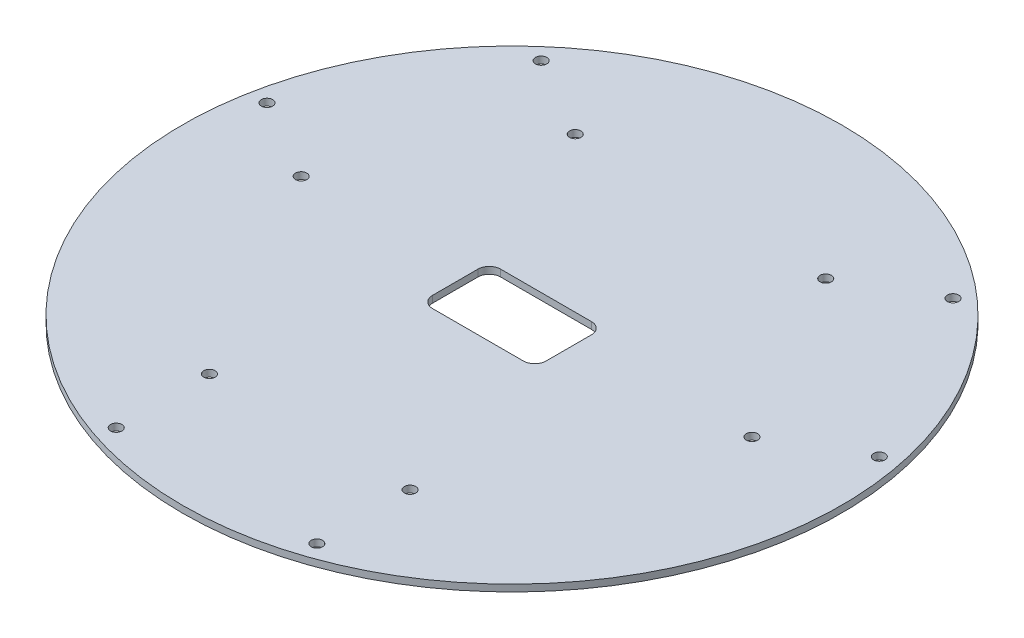
from build123d import *

# Parameters (mm, degrees)
SKETCH_1_R                   = 145
EXTRUDE_1_DEPTH              = 3
SKETCH_2_R                   = 2.5
CUT_EXTRUDE_1_DEPTH          = 10
PATTERN_CIRCULAR_1_OUTLINE_R = 2.5
PATTERN_CIRCULAR_1_DEPTH     = 3
SKETCH_5_W                   = 50
SKETCH_5_H                   = 30
CUT_EXTRUDE_2_DEPTH          = 10
FILLET_1_R                   = 5


# Read off the part's stored shape, not the designer's step: 阵列(圆周)1
with BuildPart() as part:
    # 草图1 → 凸台-拉伸1 (new body)
    with BuildSketch(Plane(origin=(0, 0, 0), x_dir=(1, 0, 0), z_dir=(0, 1, 0))):
        with Locations(Location((0, 0, 0), (0, 0, 270))):
            Circle(SKETCH_1_R)
    extrude(amount=EXTRUDE_1_DEPTH)

    # 草图2 → 切除-拉伸1 (cut)
    with BuildSketch(Plane(origin=(0, 3, 0), x_dir=(1, 0, 0), z_dir=(0, 1, 0))):
        with Locations(Location((-44.135, -89, 0), (0, 0, 270))):
            Circle(SKETCH_2_R)
        with Locations(Location((-44.135, -130, 0), (0, 0, 270))):
            Circle(SKETCH_2_R)
    cut_extrude_1 = extrude(amount=-CUT_EXTRUDE_1_DEPTH, mode=Mode.SUBTRACT)

    # 镜向1: 切除-拉伸1 across plane
    add(cut_extrude_1.mirror(Plane(origin=(0, 0, 0), x_dir=(0, 0, 1), z_dir=(1, 0, 0))), mode=Mode.SUBTRACT)

    # 阵列(圆周)1 outline → 阵列(圆周)1 (cut)
    with BuildSketch(Plane(origin=(0, 0, 0), x_dir=(1, 0, 0), z_dir=(0, 1, 0))):
        with Locations((55.121653534, 82.91756691)):
            Circle(PATTERN_CIRCULAR_1_OUTLINE_R)
        with Locations((90.628695089, 103.41756691)):
            Circle(PATTERN_CIRCULAR_1_OUTLINE_R)
        with Locations((-99.256653534, 6.473504518)):
            Circle(PATTERN_CIRCULAR_1_OUTLINE_R)
        with Locations((-134.763695089, 26.973504518)):
            Circle(PATTERN_CIRCULAR_1_OUTLINE_R)
        with Locations((99.239525897, 6.352725277)):
            Circle(PATTERN_CIRCULAR_1_OUTLINE_R)
        with Locations((-90.532661016, 103.342344321)):
            Circle(PATTERN_CIRCULAR_1_OUTLINE_R)
        with Locations((-55.025619461, 82.842344321)):
            Circle(PATTERN_CIRCULAR_1_OUTLINE_R)
        with Locations((134.746567453, 26.852725277)):
            Circle(PATTERN_CIRCULAR_1_OUTLINE_R)
    extrude(amount=PATTERN_CIRCULAR_1_DEPTH, mode=Mode.SUBTRACT)

    # 草图5 → 切除-拉伸2 (cut)
    with BuildSketch(Plane(origin=(0, 3, 0), x_dir=(1, 0, 0), z_dir=(0, 1, 0))):
        Rectangle(SKETCH_5_W, SKETCH_5_H)
    extrude(amount=-CUT_EXTRUDE_2_DEPTH, mode=Mode.SUBTRACT)

    # 圆角1
    fillet_1_edges = [part.edges().sort_by_distance(p)[0] for p in [
        (25, 1.5, -15),
        (25, 1.5, 15),
        (-25, 1.5, 15),
        (-25, 1.5, -15),
    ]]
    fillet(fillet_1_edges, radius=FILLET_1_R)


solid = part.part
